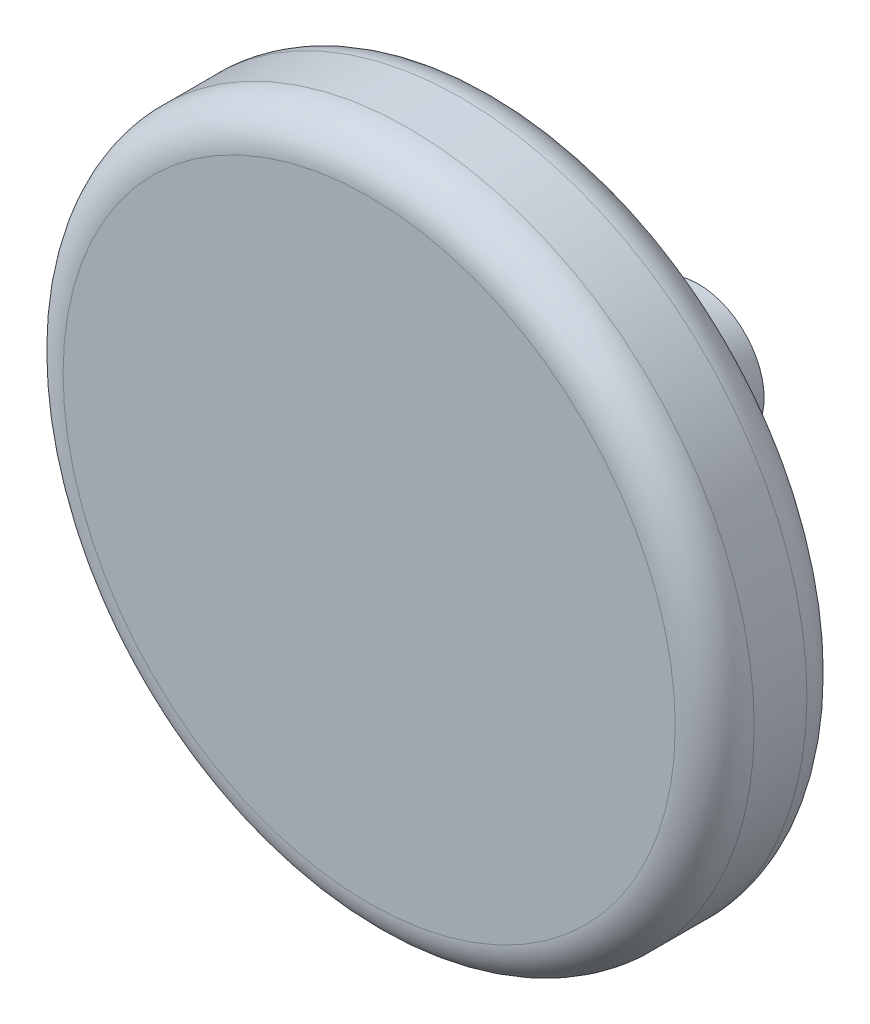
from build123d import *

# Parameters (mm, degrees)
SKETCH1_R           = 4.233333333
BOSS_EXTRUDE1_DEPTH = 12.7
SKETCH2_R           = 22.225
BOSS_EXTRUDE3_DEPTH = 8.466666667
FILLET1_R           = 12.7
FILLET2_R           = 2.54
SKETCH5_R           = 1.6256
CUT_EXTRUDE2_DEPTH  = 15.621


with BuildPart() as part:
    # Sketch1 → Boss-Extrude1 (new body)
    with BuildSketch(Plane.XY):
        Circle(SKETCH1_R)
    extrude(amount=BOSS_EXTRUDE1_DEPTH)

    # Sketch2 → Boss-Extrude3 (add)
    with BuildSketch(Plane.XY.offset(12.7)):
        Circle(SKETCH2_R)
    extrude(amount=BOSS_EXTRUDE3_DEPTH)

    # Fillet1
    fillet1_edges = [part.edges().sort_by_distance(p)[0] for p in [
        (-4.233333333, 0, 12.7),
    ]]
    fillet(fillet1_edges, radius=FILLET1_R - 0.0001)  # a hair under: the kernel refuses the full size

    # Fillet2
    fillet2_edges = [part.edges().sort_by_distance(p)[0] for p in [
        (-22.225, 0, 12.7),
        (-22.225, 0, 21.166666667),
    ]]
    fillet(fillet2_edges, radius=FILLET2_R)

    # Sketch5 → Cut-Extrude2 (cut)
    with BuildSketch(Plane(origin=(0, 0, 0), x_dir=(-1, 0, 0), z_dir=(0, 0, -1))):
        Circle(SKETCH5_R)
    extrude(amount=-CUT_EXTRUDE2_DEPTH, mode=Mode.SUBTRACT)


solid = part.part
